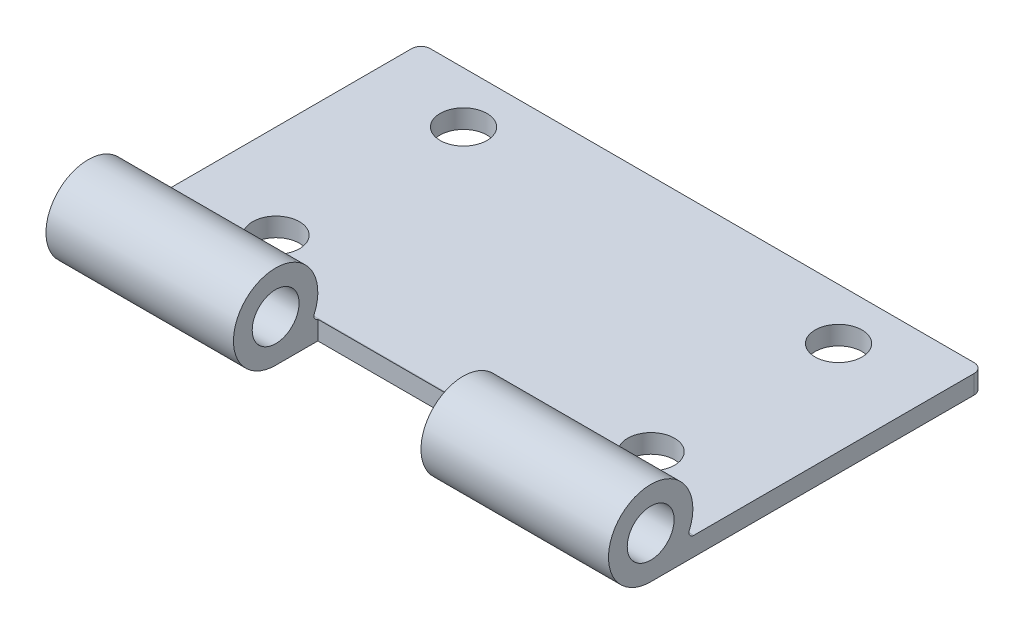
from build123d import *

# Parameters (mm, degrees)
SKETCH1_R           = 2.5
BOSS_EXTRUDE1_DEPTH = 60
SKETCH2_W           = 20
SKETCH2_H           = 9
CUT_EXTRUDE1_DEPTH  = 60
SKETCH3_R           = 2.5
CUT_EXTRUDE2_DEPTH  = 60
FILLET1_R           = 1


with BuildPart() as part:
    # Sketch1 → Boss-Extrude1 (new body)
    with BuildSketch(Plane(origin=(0, 0, 0), x_dir=(0, 0, -1), z_dir=(1, 0, 0))):
        with BuildLine():
            Line((4.048823626, 4.23802091), (-31.451176374, 4.23802091))
            ThreePointArc((-31.451176374, 4.23802091), (-33.915927882, 12.502991029), (-27.326858248, 6.93802091))
            ThreePointArc((-27.326858248, 6.93802091), (-27.286930692, 6.464159631), (-26.868600679, 6.23802091))
            Line((-26.868600679, 6.23802091), (4.048823626, 6.23802091))
            Line((4.048823626, 6.23802091), (4.048823626, 4.23802091))
        make_face()
        with Locations((-31.451176374, 8.73802091)):
            Circle(SKETCH1_R, mode=Mode.SUBTRACT)
    extrude(amount=BOSS_EXTRUDE1_DEPTH)

    # Sketch2 → Cut-Extrude1 (cut)
    with BuildSketch(Plane(origin=(0, 0, 0), x_dir=(1, 0, 0), z_dir=(0, 1, 0))):
        with Locations((30, -31.451176374)):
            Rectangle(SKETCH2_W, SKETCH2_H)
    extrude(amount=CUT_EXTRUDE1_DEPTH, mode=Mode.SUBTRACT)

    # Sketch3 → Cut-Extrude2 (cut)
    with BuildSketch(Plane(origin=(0, 6.23802091, 0), x_dir=(1, 0, 0), z_dir=(0, 1, 0))):
        with Locations((10, -1.409888526)):
            Circle(SKETCH3_R)
        with Locations((10, -21.409888526)):
            Circle(SKETCH3_R)
        with Locations((50, -21.409888526)):
            Circle(SKETCH3_R)
        with Locations((50, -1.409888526)):
            Circle(SKETCH3_R)
    extrude(amount=-CUT_EXTRUDE2_DEPTH, mode=Mode.SUBTRACT)

    # Fillet1
    fillet1_edges = [part.edges().sort_by_distance(p)[0] for p in [
        (60, 5.23802091, -4.048823626),
        (0, 5.23802091, -4.048823626),
    ]]
    fillet(fillet1_edges, radius=FILLET1_R)


solid = part.part
